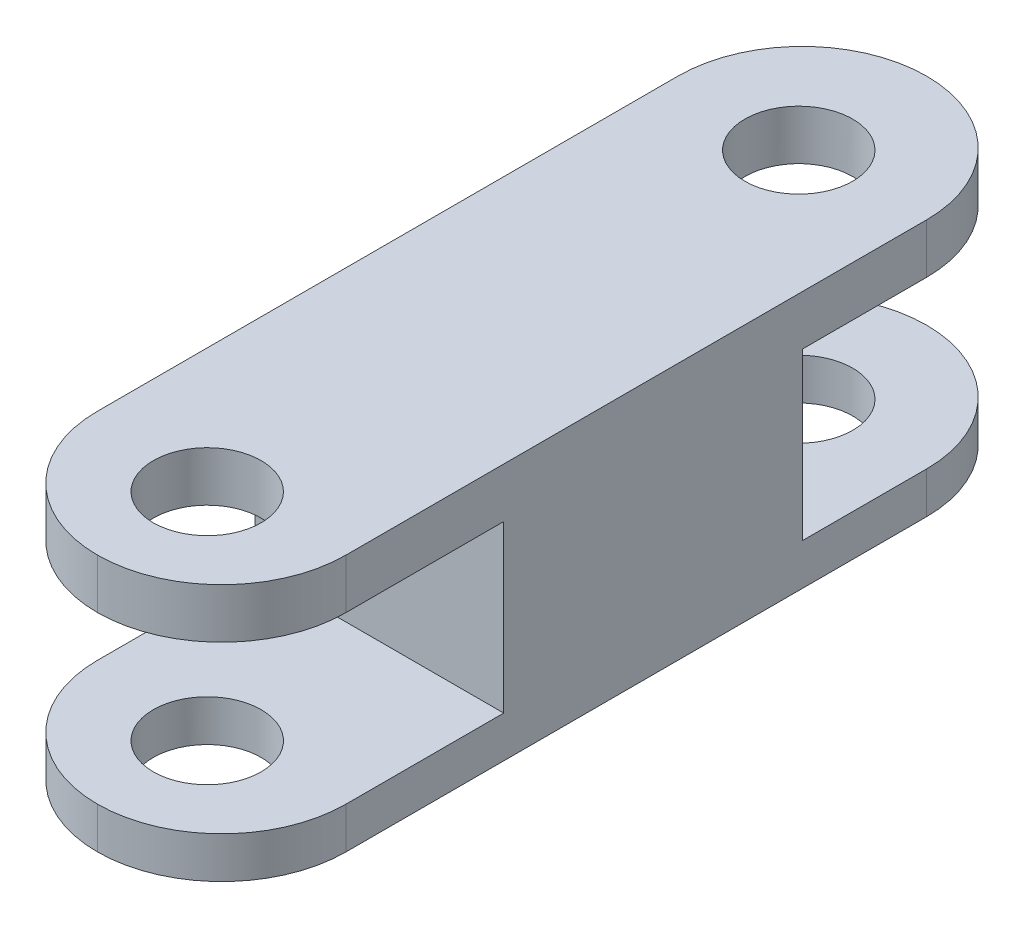
from build123d import *

# Parameters (mm, degrees)
SKETCH1_W               = 7.62
SKETCH1_H               = 25.4
EXTRUDE_THIN1_DEPTH     = 7.874
FILLET1_R               = 3.81
SKETCH3_R               = 1.651
CUT_EXTRUDE1_DEPTH      = 7.874
LPATTERN1_COUNT         = 2
LPATTERN1_PITCH         = 18.11528
SKETCH5_W               = 3.81
SKETCH5_H               = 5.08
CUT_EXTRUDE_THIN1_DEPTH = 60.226546789
CUT_EXTRUDE_THIN2_START = -7.874
SKETCH5_3_W             = 5.08
SKETCH5_3_H             = 5.08
CUT_EXTRUDE_THIN2_DEPTH = 68.100546789
LPATTERN2_COUNT         = 2
LPATTERN2_PITCH         = 18.034
LPATTERN4_COUNT         = 2
LPATTERN4_PITCH         = 18.034


with BuildPart() as part:
    # Sketch1 → Extrude-Thin1 (new body)
    with BuildSketch(Plane(origin=(0, 0, 0), x_dir=(1, 0, 0), z_dir=(0, 1, 0))):
        with Locations((-3.81, -45.504119859)):
            Rectangle(SKETCH1_W, SKETCH1_H)
    extrude(amount=EXTRUDE_THIN1_DEPTH)

    # Fillet1
    fillet1_edges = [part.edges().sort_by_distance(p)[0] for p in [
        (-7.62, 3.937, 32.804119859),
        (0, 3.937, 32.804119859),
        (0, 3.937, 58.204119859),
        (-7.62, 3.937, 58.204119859),
    ]]
    fillet(fillet1_edges, radius=FILLET1_R - 0.0001)  # a hair under: the kernel refuses the full size

    # Sketch3 → Cut-Extrude1 (cut)
    with BuildSketch(Plane(origin=(0, 7.874, 0), x_dir=(1, 0, 0), z_dir=(0, 1, 0))):
        with Locations(Location((-3.805586637, -54.841580585, 0), (0, 0, 270))):
            Circle(SKETCH3_R)
    cut_extrude1 = extrude(amount=-CUT_EXTRUDE1_DEPTH, mode=Mode.SUBTRACT)

    # LPattern1: Cut-Extrude1 ×2
    with Locations(*[(0, 0, -i * LPATTERN1_PITCH) for i in range(1, LPATTERN1_COUNT)]):
        add(cut_extrude1, mode=Mode.SUBTRACT)

    # Sketch5 → Cut-Extrude-Thin1 (cut, symmetric)
    with BuildSketch(Plane(origin=(0, 0, 0), x_dir=(0, 0, -1), z_dir=(1, 0, 0))):
        with Locations((-38.519119859, 3.808272384)):
            Rectangle(SKETCH5_W, SKETCH5_H)
    cut_extrude_thin1 = extrude(amount=CUT_EXTRUDE_THIN1_DEPTH, both=True, mode=Mode.SUBTRACT)

    # Sketch5<3> → Cut-Extrude-Thin2 (cut)
    with BuildSketch(Plane(origin=(0, 0, 0), x_dir=(0, 0, -1), z_dir=(1, 0, 0)).offset(CUT_EXTRUDE_THIN2_START)):
        with Locations((-34.074119859, 3.808272384)):
            Rectangle(SKETCH5_3_W, SKETCH5_3_H)
    cut_extrude_thin2 = extrude(amount=CUT_EXTRUDE_THIN2_DEPTH, mode=Mode.SUBTRACT)

    # LPattern2: Cut-Extrude-Thin2 ×2
    with Locations(*[(0, 0, i * LPATTERN2_PITCH) for i in range(1, LPATTERN2_COUNT)]):
        add(cut_extrude_thin2, mode=Mode.SUBTRACT)

    # LPattern4: Cut-Extrude-Thin1 ×2
    with Locations(*[(0, 0, i * LPATTERN4_PITCH) for i in range(1, LPATTERN4_COUNT)]):
        add(cut_extrude_thin1, mode=Mode.SUBTRACT)


solid = part.part
